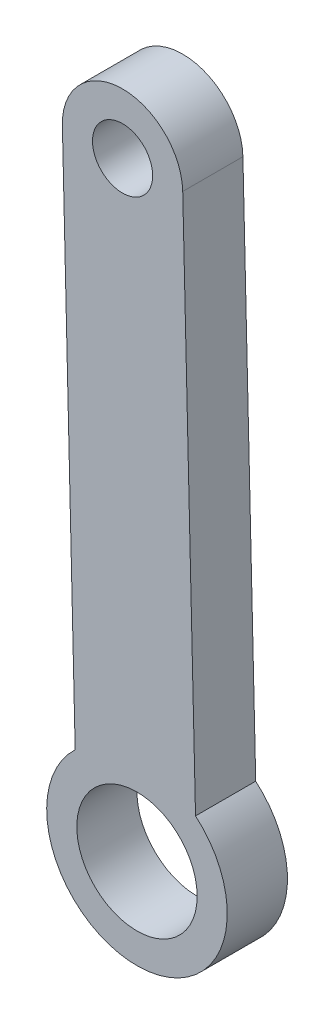
from build123d import *

# Parameters (mm, degrees)
SKETCH1_R           = 2.5
SKETCH1_R_2         = 5
BOSS_EXTRUDE1_DEPTH = 5


with BuildPart() as part:
    # Sketch1 → Boss-Extrude1 (new body)
    with BuildSketch(Plane(origin=(0, 0, 0), x_dir=(0.9997134963974095, 0.023935854295735675, 0), z_dir=(0, 0, 1))):
        with BuildLine():
            Line((10.010039278, 5.570210903), (10.010039278, 49.980040959))
            ThreePointArc((10.010039278, 49.980040959), (5.010039278, 54.980040959), (0.010039278, 49.980040959))
            Line((0.010039278, 49.980040959), (0.010039278, 5.570210903))
            ThreePointArc((0.010039278, 5.570210903), (5.010039278, -7.519959041), (10.010039278, 5.570210903))
        make_face()
        with Locations((5.010039278, 49.980040959)):
            Circle(SKETCH1_R, mode=Mode.SUBTRACT)
        with Locations((5.010039278, -0.019959041)):
            Circle(SKETCH1_R_2, mode=Mode.SUBTRACT)
    extrude(amount=BOSS_EXTRUDE1_DEPTH)


solid = part.part
